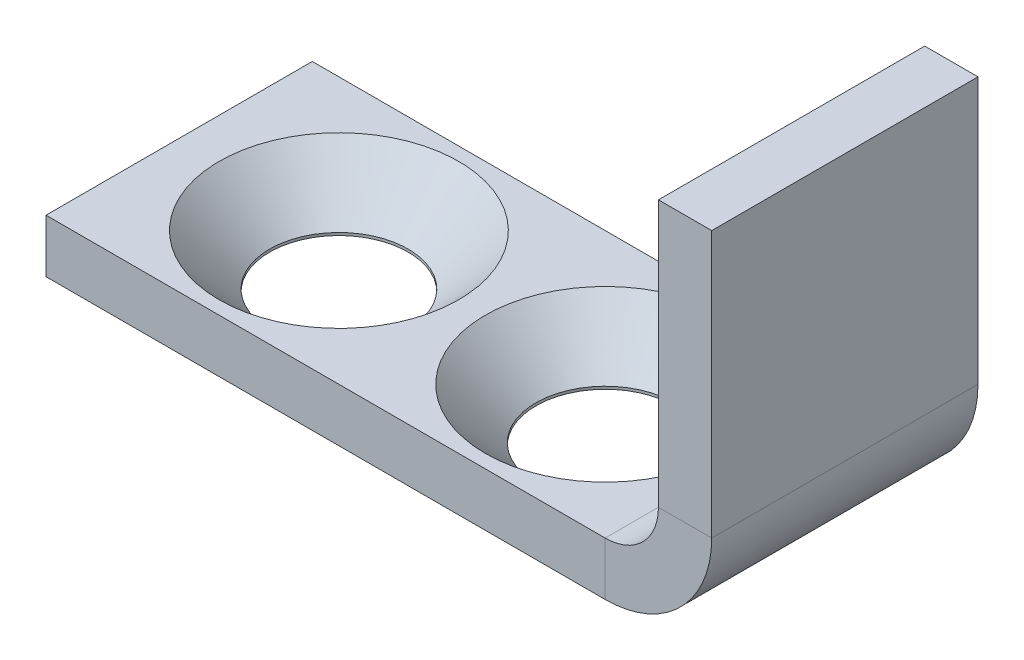
from build123d import *

# Parameters (mm, degrees)
BASE_FLANGE1_DEPTH                          = 5
CSK_FOR_M2_CROSS_RECESSED_CTSK_HEAD_2_COUNT = 2
CSK_FOR_M2_CROSS_RECESSED_CTSK_HEAD_2_PITCH = 5


# Sheet-metal steps are written as plain solids
with BuildPart() as part:
    # Sketch1 → Base-Flange1 (new body)
    with BuildSketch(Plane.XY):
        with BuildLine():
            Line((-11.5, 0), (-1, 0))
            ThreePointArc((-1, 0), (-0.292893219, 0.292893219), (0, 1))
            Line((0, 1), (0, 6))
            Line((0, 6), (1, 6))
            Line((1, 6), (1, 1))
            ThreePointArc((1, 1), (0.414213562, -0.414213562), (-1, -1))
            Line((-1, -1), (-11.5, -1))
            Line((-11.5, -1), (-11.5, 0))
        make_face()
    extrude(amount=BASE_FLANGE1_DEPTH)

    # Sketch3 → CSK for M2 Cross recessed CTSK head wood screws1 (revolve, cut)
    with BuildSketch(Plane(origin=(-8.5, 0, 2.5), x_dir=(0, 0, 1), z_dir=(1, 0, 0))):
        Polygon((0, 0), (0, 1), (1.3, 1), (1.3, 0.95), (2.25, 0), align=None)
    csk_for_m2_cross_recessed_ctsk_head_wood = revolve(axis=Axis((-8.5, 6.35, 2.5), (0, -1, 0)), mode=Mode.SUBTRACT)

    # CSK for M2 Cross recessed CTSK head  2: CSK for M2 Cross recessed CTSK head wood screws1 ×2
    with Locations(*[(i * CSK_FOR_M2_CROSS_RECESSED_CTSK_HEAD_2_PITCH, 0, 0) for i in range(1, CSK_FOR_M2_CROSS_RECESSED_CTSK_HEAD_2_COUNT)]):
        add(csk_for_m2_cross_recessed_ctsk_head_wood, mode=Mode.SUBTRACT)


solid = part.part
